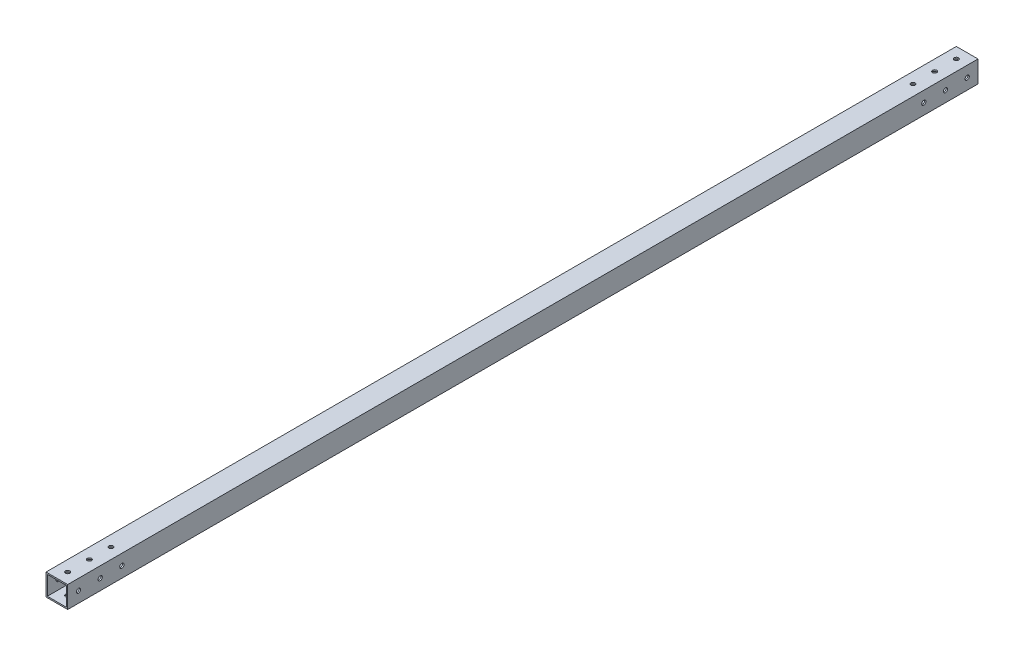
from build123d import *

# Parameters (mm, degrees)
SKETCH1_W           = 25.4
SKETCH1_H           = 25.4
BOSS_EXTRUDE1_DEPTH = 533.4
SHELL1_T            = -1.5875
SKETCH3_R           = 2.4892
CUT_EXTRUDE1_DEPTH  = 533.4
SKETCH4_R           = 2.4892
CUT_EXTRUDE2_DEPTH  = 533.4


with BuildPart() as part:
    # Sketch1 → Boss-Extrude1 (new, symmetric)
    with BuildSketch(Plane.XY):
        with Locations((12.7, 12.7)):
            Rectangle(SKETCH1_W, SKETCH1_H)
    extrude(amount=BOSS_EXTRUDE1_DEPTH, both=True)

    # Shell1
    shell1_openings = [part.faces().sort_by_distance(p)[0] for p in [
        (12.7, 12.7, -533.4),
        (12.7, 12.7, 533.4),
    ]]
    offset(amount=SHELL1_T, openings=shell1_openings, kind=Kind.INTERSECTION)

    # Sketch3 → Cut-Extrude1 (cut, symmetric)
    with BuildSketch(Plane(origin=(0, 25.4, 0), x_dir=(1, 0, 0), z_dir=(0, 1, 0))):
        with Locations((12.7, -520.7)):
            Circle(SKETCH3_R)
        with Locations((12.7, -495.3)):
            Circle(SKETCH3_R)
        with Locations((12.7, -469.9)):
            Circle(SKETCH3_R)
    cut_extrude1 = extrude(amount=CUT_EXTRUDE1_DEPTH, both=True, mode=Mode.SUBTRACT)

    # Sketch4 → Cut-Extrude2 (cut, symmetric)
    with BuildSketch(Plane.ZY):
        with Locations((520.7, 12.7)):
            Circle(SKETCH4_R)
        with Locations((495.3, 12.7)):
            Circle(SKETCH4_R)
        with Locations((469.9, 12.7)):
            Circle(SKETCH4_R)
    cut_extrude2 = extrude(amount=CUT_EXTRUDE2_DEPTH, both=True, mode=Mode.SUBTRACT)

    # Mirror1: Cut-Extrude1, Cut-Extrude2 across plane
    add(cut_extrude1.mirror(Plane.XY), mode=Mode.SUBTRACT)
    add(cut_extrude2.mirror(Plane.XY), mode=Mode.SUBTRACT)


solid = part.part
